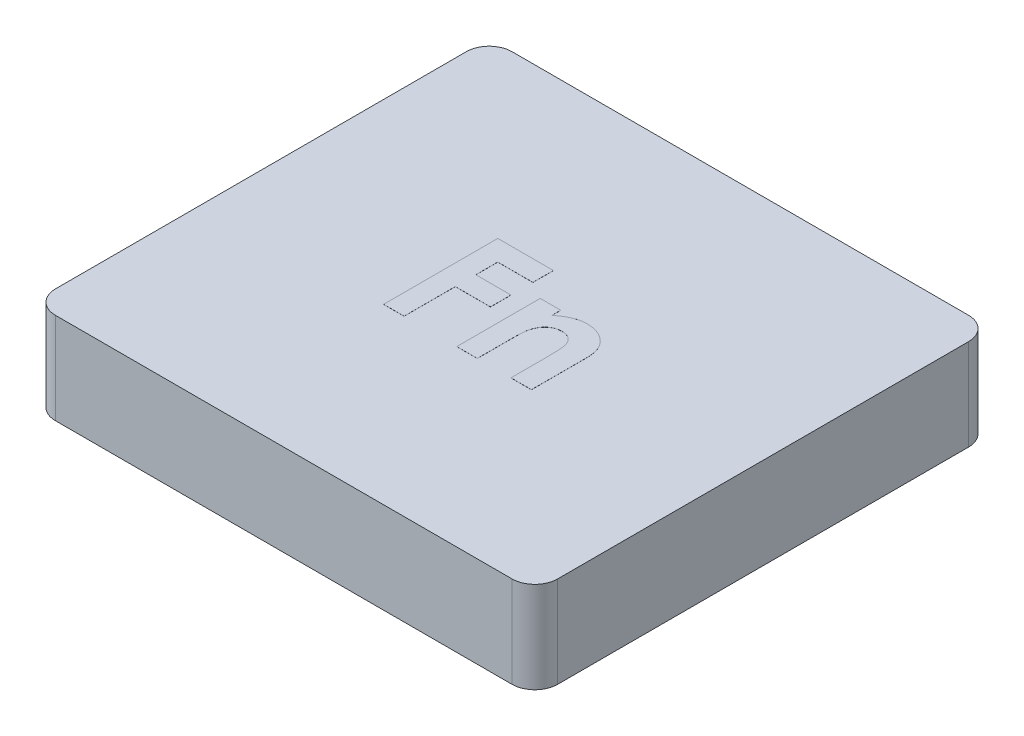
from build123d import *

# Parameters (mm, degrees)
SKETCH1_W           = 13.97
SKETCH1_H           = 12.7
BOSS_EXTRUDE1_DEPTH = 2.54
FILLET1_R           = 0.635
SHELL1_START        = 0.635
SHELL1_OUTLINE_W    = 1.905
SHELL1_OUTLINE_H    = 11.43
SHELL1_DEPTH        = 12.7
SKETCH2_R           = 2.54
BOSS_EXTRUDE2_DEPTH = 1.905
BOSS_EXTRUDE3_DEPTH = 0.00254


# Read off the part's stored shape, not the designer's step: Shell1
with BuildPart() as part:
    # Sketch1 → Boss-Extrude1 (new body)
    with BuildSketch(Plane(origin=(0, 0, 0), x_dir=(1, 0, 0), z_dir=(0, 1, 0))):
        with Locations((6.985, 6.35)):
            Rectangle(SKETCH1_W, SKETCH1_H)
    extrude(amount=BOSS_EXTRUDE1_DEPTH)

    # Fillet1
    fillet1_edges = [part.edges().sort_by_distance(p)[0] for p in [
        (0, 1.27, -12.7),
        (13.97, 1.27, -12.7),
        (13.97, 1.27, 0),
        (0, 1.27, 0),
    ]]
    fillet(fillet1_edges, radius=FILLET1_R)

    # Shell1 outline → Shell1 (cut)
    with BuildSketch(Plane.YZ.offset(SHELL1_START)):
        with Locations((0.9525, -6.35)):
            Rectangle(SHELL1_OUTLINE_W, SHELL1_OUTLINE_H)
    extrude(amount=SHELL1_DEPTH, mode=Mode.SUBTRACT)

    # Sketch2 → Boss-Extrude2 (add)
    with BuildSketch(Plane(origin=(0, 1.905, 0), x_dir=(-1, 0, 0), z_dir=(0, -1, 0))):
        with Locations(Location((-6.985, 6.35, 0), (0, 0, 270))):
            Circle(SKETCH2_R)
    extrude(amount=BOSS_EXTRUDE2_DEPTH)

    # Sketch3 → Boss-Extrude3 (add)
    with BuildSketch(Plane(origin=(0, 2.54, 0), x_dir=(1, 0, 0), z_dir=(0, 1, 0))):
        Polygon((4.938346154, 8.001), (6.485141026, 8.001), (6.485141026, 7.431128205), (5.508217949, 7.431128205), (5.508217949, 6.820551282), (6.485141026, 6.820551282), (6.485141026, 6.250679487), (5.508217949, 6.250679487), (5.508217949, 4.826), (4.938346154, 4.826), align=None)
        with BuildLine():
            Line((6.973602564, 7.146192308), (7.543474359, 7.146192308))
            Line((7.543474359, 7.146192308), (7.543474359, 6.900689503))
            add(Edge.make_bspline(
                [(7.543474359, 6.900689503), (7.575985262, 6.925977153), (7.638119919, 6.974306769), (7.732575324, 7.035927275), (7.821729533, 7.086361185), (7.907569887, 7.124723797), (7.991711475, 7.152324047), (8.075517031, 7.172153181), (8.160234588, 7.18485032), (8.217185351, 7.18621543), (8.245637821, 7.186897436)],
                knots=[0, 0, 0, 0, 1.276643801, 2.439914479, 3.493451431, 4.44993799, 5.350072675, 6.235028322, 7.118224225, 8, 8, 8, 8], degree=3))
            add(Edge.make_bspline(
                [(8.245637821, 7.186897436), (8.274499022, 7.186118044), (8.331155985, 7.184588033), (8.41458024, 7.173886845), (8.494284014, 7.154396591), (8.57116351, 7.128518806), (8.644436227, 7.094361613), (8.714999799, 7.053805489), (8.781338547, 7.004405385), (8.822192885, 6.966784638), (8.842858373, 6.947754808)],
                knots=[0, 0, 0, 0, 1.048836932, 2.058954983, 3.049370783, 4.026390553, 5.001981509, 5.982488534, 6.97947532, 8, 8, 8, 8], degree=3))
            add(Edge.make_bspline(
                [(8.842858373, 6.947754808), (8.859432856, 6.93011972), (8.892703126, 6.894720476), (8.934569582, 6.834143303), (8.970495709, 6.768103097), (8.999932179, 6.695838062), (9.021684544, 6.616951149), (9.038418936, 6.532395199), (9.047808895, 6.441696762), (9.048968129, 6.379387791), (9.049564103, 6.347354167)],
                knots=[0, 0, 0, 0, 0.889584746, 1.785680191, 2.700364693, 3.65222533, 4.649950538, 5.707241244, 6.821271309, 8, 8, 8, 8], degree=3))
            Line((9.049564103, 6.347354167), (9.049564103, 4.826))
            Line((9.049564103, 4.826), (8.479692308, 4.826))
            Line((8.479692308, 4.826), (8.479692308, 5.833451923))
            add(Edge.make_bspline(
                [(8.479692308, 5.833451923), (8.479571792, 5.86631325), (8.479340847, 5.929285883), (8.477567699, 6.019409185), (8.474105481, 6.10080223), (8.470949759, 6.173613213), (8.464753823, 6.237583603), (8.459166228, 6.293118384), (8.450592604, 6.339713739), (8.439436929, 6.389834035), (8.419956373, 6.443496978), (8.38971376, 6.500039753), (8.351346764, 6.548074101), (8.306422447, 6.587936766), (8.254990424, 6.619471791), (8.197672176, 6.641658645), (8.134774997, 6.655486038), (8.090948982, 6.656963488), (8.068188902, 6.657730769)],
                knots=[0, 0, 0, 0, 1.49886392, 2.872294502, 4.110984203, 5.214877267, 6.195405875, 7.042225351, 7.75923308, 8.355011229, 9.382752534, 10.352059385, 11.267231453, 12.171456522, 13.078624015, 14.003401117, 14.963110155, 16, 16, 16, 16], degree=3))
            add(Edge.make_bspline(
                [(8.068188902, 6.657730769), (8.038588461, 6.656229723), (7.980684244, 6.653293385), (7.896937378, 6.631150715), (7.820017276, 6.593492551), (7.75055244, 6.541381225), (7.689204465, 6.477043335), (7.638676644, 6.400313021), (7.597233451, 6.313042165), (7.579412262, 6.249320264), (7.570187099, 6.216334535)],
                knots=[0, 0, 0, 0, 0.984188326, 1.925263693, 2.85911992, 3.81709677, 4.80007086, 5.801799564, 6.862098548, 8, 8, 8, 8], degree=3))
            add(Edge.make_bspline(
                [(7.570187099, 6.216334535), (7.56789428, 6.205975146), (7.562780832, 6.182871626), (7.558575667, 6.143840753), (7.552725978, 6.097534401), (7.550534244, 6.043114556), (7.546723058, 5.980838765), (7.5453135, 5.910624637), (7.543901419, 5.83260985), (7.543621428, 5.778119486), (7.543474359, 5.749497596)],
                knots=[0, 0, 0, 0, 0.543362196, 1.211806945, 2.009705693, 2.934833164, 4.000995085, 5.207458376, 6.533175157, 8, 8, 8, 8], degree=3))
            Line((7.543474359, 5.749497596), (7.543474359, 4.826))
            Line((7.543474359, 4.826), (6.973602564, 4.826))
            Line((6.973602564, 4.826), (6.973602564, 7.146192308))
        make_face()
    extrude(amount=BOSS_EXTRUDE3_DEPTH)


solid = part.part
